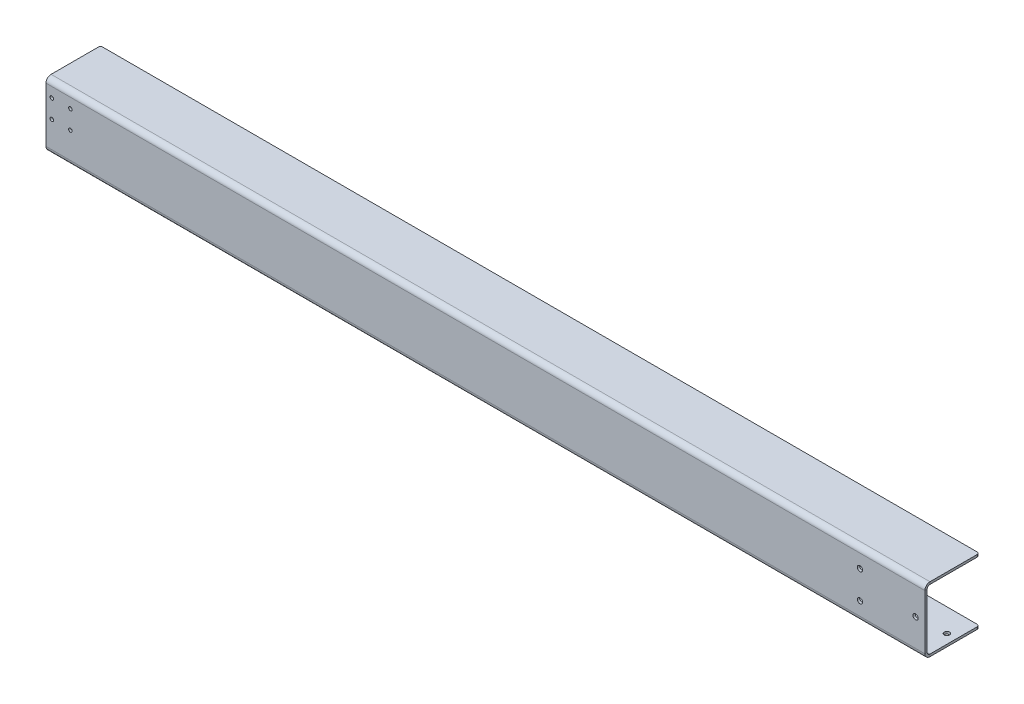
from build123d import *

# Parameters (mm, degrees)
SKETCH1_W                           = 1203.325
SKETCH1_H                           = 74.6125
BASE_FLANGE1_DEPTH                  = 3.175
EDGE_FLANGE1_STRIP_W                = 20.32
EDGE_FLANGE1_STRIP_H                = 3.175
EDGE_FLANGE1_STRIP_CUT_DEPTH        = 1203.325
EDGE_FLANGE1_DEPTH                  = 1203.325
EDGE_FLANGE2_STRIP_W                = 20.32
EDGE_FLANGE2_STRIP_H                = 3.175
EDGE_FLANGE2_STRIP_CUT_DEPTH        = 1203.325
EDGE_FLANGE2_DEPTH                  = 1203.325
F_9_32_0_28125_DIAMETER_HOLE3_D     = 7.14375
F_9_32_0_28125_DIAMETER_HOLE3_DEPTH = 3.175
FILLET1_R                           = 3.175
F_9_32_0_28125_DIAMETER_HOLE1_D     = 7.14375
F_9_32_0_28125_DIAMETER_HOLE1_DEPTH = 3.175
F_9_32_0_28125_DIAMETER_HOLE2_D     = 7.14375
F_1_1_71_DOWEL_SLOT1_DEPTH          = 3.175
F_10_0_1935_DIAMETER_HOLE1_D        = 4.9149
LPATTERN2_COUNT                     = 2
LPATTERN2_PITCH                     = 25.4
LPATTERN2_COUNT_DIR2                = 2
LPATTERN2_PITCH_DIR2                = 25.4


# Read off the part's stored shape, not the designer's step: 1 (1.71) Dowel Slot1
# Sheet-metal steps are written as plain solids
with BuildPart() as part:
    # Sketch1 → Base-Flange1 (new body)
    with BuildSketch(Plane(origin=(0, 0, 0), x_dir=(1, 0, 0), z_dir=(0, 1, 0))):
        Rectangle(SKETCH1_W, SKETCH1_H)
    extrude(amount=BASE_FLANGE1_DEPTH)

    # Edge-Flange1 strip (across the edge) → Edge-Flange1 strip cut (cut)
    with BuildSketch(Plane(origin=(-601.6625, 3.175, 37.30625), x_dir=(0, 0, -1), z_dir=(1, 0, 0))):
        with Locations((-3.175, -1.5875)):
            Rectangle(EDGE_FLANGE1_STRIP_W, EDGE_FLANGE1_STRIP_H)
    extrude(amount=EDGE_FLANGE1_STRIP_CUT_DEPTH, mode=Mode.SUBTRACT)

    # Edge-Flange1 section (across the edge) → Edge-Flange1 (add)
    with BuildSketch(Plane(origin=(-601.6625, 3.175, 37.30625), x_dir=(0, 0, -1), z_dir=(1, 0, 0))):
        with BuildLine():
            Line((0, 3.81), (0, 85.725))
            Line((0, 85.725), (3.175, 85.725))
            Line((3.175, 85.725), (3.175, 3.81))
            ThreePointArc((3.175, 3.81), (4.290923164, 1.115923164), (6.985, 0))
            Line((6.985, 0), (6.985, -3.175))
            ThreePointArc((6.985, -3.175), (2.045859133, -1.129140867), (0, 3.81))
        make_face()
    extrude(amount=EDGE_FLANGE1_DEPTH)

    # Edge-Flange2 strip (across the edge) → Edge-Flange2 strip cut (cut)
    with BuildSketch(Plane(origin=(-601.6625, 88.9, 34.13125), x_dir=(0, -1, 0), z_dir=(1, 0, 0))):
        with Locations((-3.175, -1.5875)):
            Rectangle(EDGE_FLANGE2_STRIP_W, EDGE_FLANGE2_STRIP_H)
    extrude(amount=EDGE_FLANGE2_STRIP_CUT_DEPTH, mode=Mode.SUBTRACT)

    # Edge-Flange2 section (across the edge) → Edge-Flange2 (add)
    with BuildSketch(Plane(origin=(-601.6625, 88.9, 34.13125), x_dir=(0, -1, 0), z_dir=(1, 0, 0))):
        with BuildLine():
            Line((0, 3.81), (0, 71.4375))
            Line((0, 71.4375), (3.175, 71.4375))
            Line((3.175, 71.4375), (3.175, 3.81))
            ThreePointArc((3.175, 3.81), (4.290923164, 1.115923164), (6.985, 0))
            Line((6.985, 0), (6.985, -3.175))
            ThreePointArc((6.985, -3.175), (2.045859133, -1.129140867), (0, 3.81))
        make_face()
    extrude(amount=EDGE_FLANGE2_DEPTH)

    # 9/32 (0.28125) Diameter Hole3
    with Locations(Plane(origin=(0, 0, 0), x_dir=(-1, 0, 0), z_dir=(0, -1, 0))):
        with Locations((446.0875, -11.90625), (446.0875, 26.19375), (485.775, 24.60625), (485.775, -13.49375), (406.4, -13.49375), (406.4, 24.60625)):
            Hole(F_9_32_0_28125_DIAMETER_HOLE3_D / 2, depth=F_9_32_0_28125_DIAMETER_HOLE3_DEPTH)

    # Fillet1
    fillet1_edges = [part.edges().sort_by_distance(p)[0] for p in [
        (-601.6625, 87.3125, -37.30625),
        (601.6625, 87.3125, -37.30625),
        (-601.6625, 1.5875, -37.30625),
        (601.6625, 1.5875, -37.30625),
    ]]
    fillet(fillet1_edges, radius=FILLET1_R)

    # 9/32 (0.28125) Diameter Hole1
    with Locations(Plane(origin=(0, 0, 0), x_dir=(-1, 0, 0), z_dir=(0, -1, 0))):
        with Locations((-588.9625, 5.55625), (-512.7625, -13.49375), (-512.7625, 24.60625)):
            Hole(F_9_32_0_28125_DIAMETER_HOLE1_D / 2, depth=F_9_32_0_28125_DIAMETER_HOLE1_DEPTH)

    # 9/32 (0.28125) Diameter Hole2 (through all)
    with Locations(Plane.XY.offset(37.30625)):
        with Locations((588.9625, 44.45), (512.7625, 63.5), (512.7625, 25.4)):
            Hole(F_9_32_0_28125_DIAMETER_HOLE2_D / 2)

    # 1 (1.71) Dowel Slot1 outline → 1 (1.71) Dowel Slot1 (cut)
    with BuildSketch(Plane(origin=(0, 0, 0), x_dir=(1, 0, 0), z_dir=(0, 1, 0))):
        with BuildLine():
            ThreePointArc((382.87325, 3.20675), (361.15625, 24.92375), (339.43925, 3.20675))
            Line((339.43925, 3.20675), (339.43925, -1.61925))
            ThreePointArc((339.43925, -1.61925), (361.15625, -23.33625), (382.87325, -1.61925))
            Line((382.87325, -1.61925), (382.87325, 3.20675))
        make_face()
        with BuildLine():
            ThreePointArc((-98.13925, 3.20675), (-119.85625, 24.92375), (-141.57325, 3.20675))
            Line((-141.57325, 3.20675), (-141.57325, -1.61925))
            ThreePointArc((-141.57325, -1.61925), (-119.85625, -23.33625), (-98.13925, -1.61925))
            Line((-98.13925, -1.61925), (-98.13925, 3.20675))
        make_face()
    extrude(amount=F_1_1_71_DOWEL_SLOT1_DEPTH, mode=Mode.SUBTRACT)

    # #10 (0.1935) Diameter Hole1 (through all)
    with Locations(Plane.XY.offset(37.30625)):
        with Locations((-593.725, 68.2625)):
            f_10_0_1935_diameter_hole1 = Hole(F_10_0_1935_DIAMETER_HOLE1_D / 2)

    # LPattern2: 10 _0.1935_ Diameter Hole1 2 × 2
    with Locations(*[(i * LPATTERN2_PITCH, -j * LPATTERN2_PITCH_DIR2, 0) for i in range(LPATTERN2_COUNT) for j in range(LPATTERN2_COUNT_DIR2) if (i, j) != (0, 0)]):
        add(f_10_0_1935_diameter_hole1, mode=Mode.SUBTRACT)


solid = part.part
